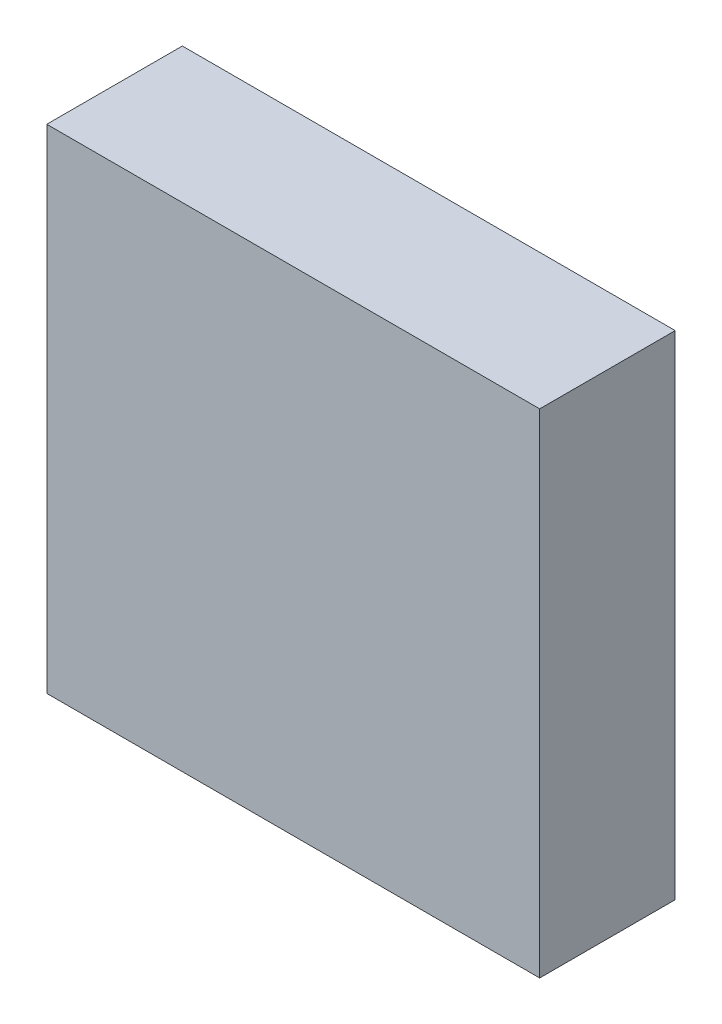
from build123d import *

# Parameters (mm, degrees)
SKETCH1_R           = 150
BOSS_EXTRUDE1_DEPTH = 25
SKETCH2_W           = 400
SKETCH2_H           = 400
SKETCH2_R           = 160
BOSS_EXTRUDE2_DEPTH = 30
SKETCH3_W           = 400
SKETCH3_H           = 400
BOSS_EXTRUDE3_DEPTH = 25


with BuildPart() as part:
    # Sketch1 → Boss-Extrude1 (new, symmetric)
    with BuildSketch(Plane.XY):
        Circle(SKETCH1_R)
    extrude(amount=BOSS_EXTRUDE1_DEPTH, both=True)


with BuildPart() as body_2:
    # Sketch2 → Boss-Extrude2 (new, symmetric)
    with BuildSketch(Plane.XY):
        Rectangle(SKETCH2_W, SKETCH2_H)
        Circle(SKETCH2_R, mode=Mode.SUBTRACT)
    extrude(amount=BOSS_EXTRUDE2_DEPTH, both=True)

    # Sketch3 → Boss-Extrude3 (add)
    with BuildSketch(Plane.XY.offset(30)):
        Rectangle(SKETCH3_W, SKETCH3_H)
    boss_extrude3 = extrude(amount=BOSS_EXTRUDE3_DEPTH)

    # Mirror1: Boss-Extrude3 across plane
    add(boss_extrude3.mirror(Plane.XY))


solid = Compound([part.part, body_2.part])
